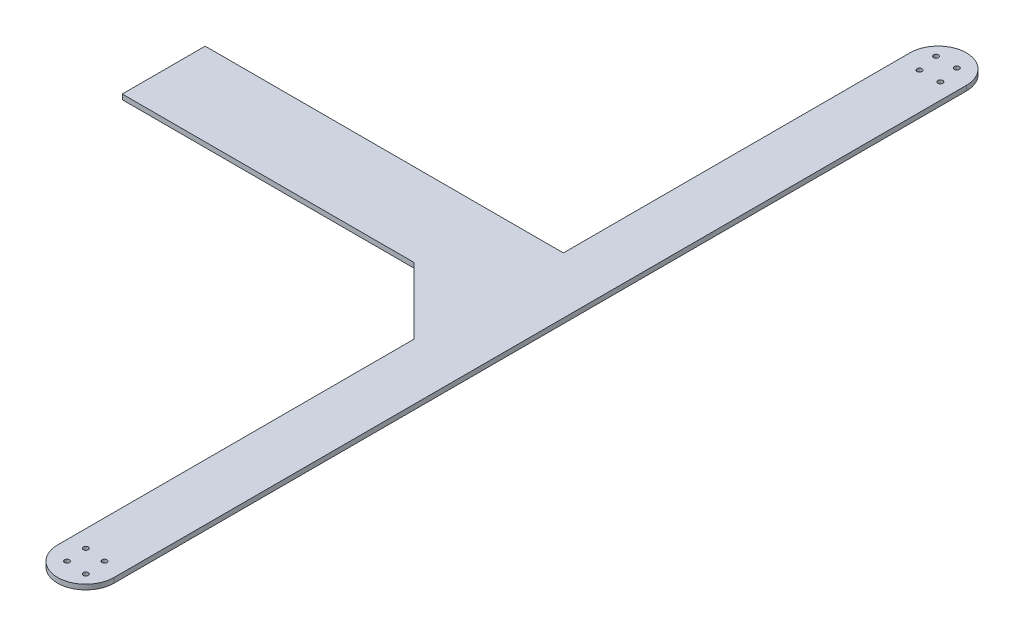
from build123d import *

# Parameters (mm, degrees)
SKETCH1_R           = 1.5
BOSS_EXTRUDE1_DEPTH = 3


with BuildPart() as part:
    # Sketch1 → Boss-Extrude1 (new body)
    with BuildSketch(Plane(origin=(0, 0, 0), x_dir=(1, 0, 0), z_dir=(0, 1, 0))):
        with BuildLine():
            Line((0, 50), (0, 0))
            Line((0, 0), (176, 0))
            Line((176, 0), (216, -40))
            Line((216, -40), (216, -255))
            ThreePointArc((216, -255), (233, -272), (250, -255))
            Line((250, -255), (250, 259.060301809))
            ThreePointArc((250, 259.060301809), (233, 276.060301809), (216, 259.060301809))
            Line((216, 259.060301809), (216, 50))
            Line((216, 50), (0, 50))
        make_face()
        with Locations((227.343145751, -260.656854249)):
            Circle(SKETCH1_R, mode=Mode.SUBTRACT)
        with Locations((226.282485579, -248.282485579)):
            Circle(SKETCH1_R, mode=Mode.SUBTRACT)
        with Locations((239.717514421, -261.717514421)):
            Circle(SKETCH1_R, mode=Mode.SUBTRACT)
        with Locations((238.656854249, -249.343145751)):
            Circle(SKETCH1_R, mode=Mode.SUBTRACT)
        with Locations((227.907830631, 252.890227975)):
            Circle(SKETCH1_R, mode=Mode.SUBTRACT)
        with Locations((225.673037322, 265.107252935)):
            Circle(SKETCH1_R, mode=Mode.SUBTRACT)
        with Locations((240.326962678, 253.013350683)):
            Circle(SKETCH1_R, mode=Mode.SUBTRACT)
        with Locations((238.092169369, 265.230375643)):
            Circle(SKETCH1_R, mode=Mode.SUBTRACT)
    extrude(amount=BOSS_EXTRUDE1_DEPTH)


solid = part.part
